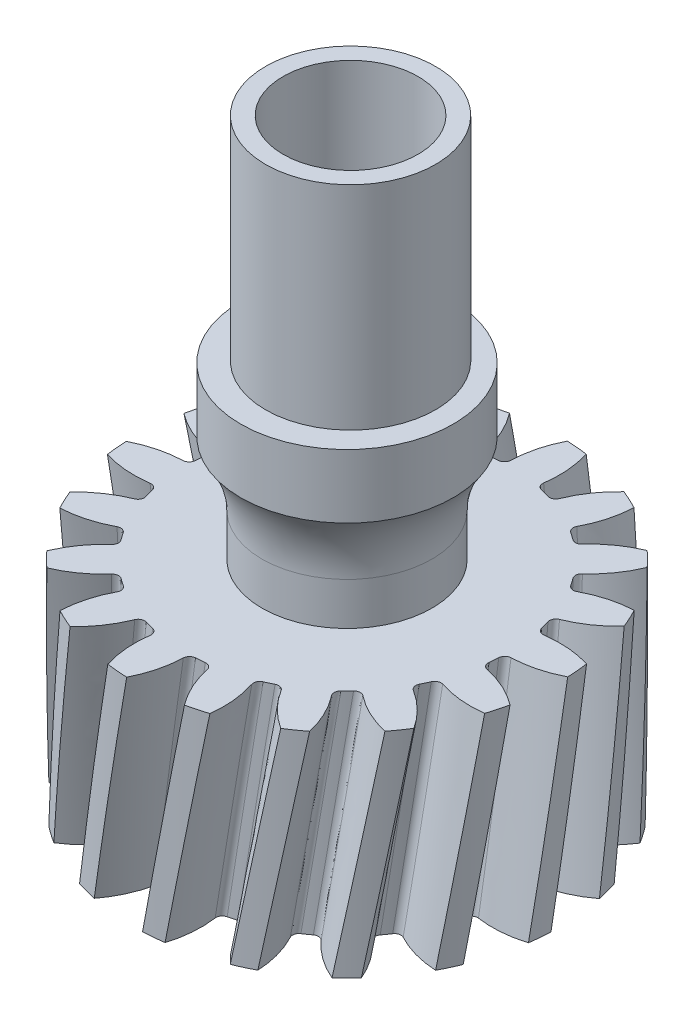
from build123d import *

# Parameters (mm, degrees)
SKETCH1_R                = 10
BOSS_EXTRUDE1_DEPTH      = 5
FILLET2_R                = 0.3
CIRPATTERN3_COUNT        = 18
FILLET2_OF_CIRPATTERN3_R = 0.3
SKETCH8_R                = 4
BOSS_EXTRUDE2_DEPTH      = 5
SKETCH9_R                = 5
BOSS_EXTRUDE4_DEPTH      = 3
FILLET3_R                = 5
SKETCH10_R               = 4
SKETCH10_R_2             = 3.175
BOSS_EXTRUDE5_DEPTH      = 10


with BuildPart() as part:
    # Sketch1 → Boss-Extrude1 (new, symmetric)
    with BuildSketch(Plane(origin=(0, 0, 0), x_dir=(1, 0, 0), z_dir=(0, 1, 0))):
        with Locations(Location((0, 0, 0), (0, 0, 270))):
            Circle(SKETCH1_R)
    extrude(amount=BOSS_EXTRUDE1_DEPTH, both=True)

    # Sketch6 for Cut-Loft1 → Cut-Loft1 section 0
    with BuildSketch(Plane(origin=(0, 5, 0), x_dir=(0.9961060179361225, 0, -0.08816349035423374), z_dir=(0, 1, 0))):
        with BuildLine():
            # circular arc as an exact rational Bezier (weights 1, cos(half-angle), 1)
            Bezier((-1.978587615, 10.820591067), (-0.618030087, 9.485843788), (-0.494114302, 7.58392056), weights=[1, 0.934139297, 1])
            Bezier((-0.494114302, 7.58392056), (0, 7.616113532), (0.494114302, 7.58392056), weights=[1, 0.997884284, 1])
            Bezier((0.494114302, 7.58392056), (0.618030087, 9.485843788), (1.978587615, 10.820591067), weights=[1, 0.934139297, 1])
            Bezier((1.978587615, 10.820591067), (0, 11.182383591), (-1.978587615, 10.820591067), weights=[1, 0.983690097, 1])
        make_face()
    # Sketch2 for Cut-Loft1 → Cut-Loft1 section 1
    with BuildSketch(Plane(origin=(0, 0, 0), x_dir=(1, 0, 0), z_dir=(0, 1, 0))):
        with BuildLine():
            Bezier((-1.978587615, 10.820591067), (-0.618030087, 9.485843788), (-0.494114302, 7.58392056), weights=[1, 0.934139297, 1])
            Bezier((-0.494114302, 7.58392056), (0, 7.616113532), (0.494114302, 7.58392056), weights=[1, 0.997884284, 1])
            Bezier((0.494114302, 7.58392056), (0.618030087, 9.485843788), (1.978587615, 10.820591067), weights=[1, 0.934139297, 1])
            Bezier((1.978587615, 10.820591067), (0, 11.182383591), (-1.978587615, 10.820591067), weights=[1, 0.983690097, 1])
        make_face()
    # Sketch7 for Cut-Loft1 → Cut-Loft1 section 2
    with BuildSketch(Plane(origin=(0, -5, 0), x_dir=(0.9961060179361226, 0, 0.08816349035423311), z_dir=(0, 1, 0))):
        with BuildLine():
            Bezier((-1.978587615, 10.820591067), (-0.618030087, 9.485843788), (-0.494114302, 7.58392056), weights=[1, 0.934139297, 1])
            Bezier((-0.494114302, 7.58392056), (0, 7.616113532), (0.494114302, 7.58392056), weights=[1, 0.997884284, 1])
            Bezier((0.494114302, 7.58392056), (0.618030087, 9.485843788), (1.978587615, 10.820591067), weights=[1, 0.934139297, 1])
            Bezier((1.978587615, 10.820591067), (0, 11.182383591), (-1.978587615, 10.820591067), weights=[1, 0.983690097, 1])
        make_face()
    cut_loft1 = loft(mode=Mode.SUBTRACT)

    # Fillet2
    fillet2_edges = [part.edges().sort_by_distance(p)[0] for p in [
        (0.494114302, 0, -7.58392056),
        (-0.494114302, 0, -7.58392056),
    ]]
    fillet(fillet2_edges, radius=FILLET2_R)

    # CirPattern3: Cut-Loft1 ×18 about axis
    cirpattern3_axis = Axis((0, 5, 0), (0, -1, 0))
    for i in range(1, CIRPATTERN3_COUNT):
        add(cut_loft1.rotate(cirpattern3_axis, i * 360 / CIRPATTERN3_COUNT), mode=Mode.SUBTRACT)

    # Fillet2 of CirPattern3
    fillet2_of_cirpattern3_edges = [part.edges().sort_by_distance(p)[0] for p in [
        (3.05816916, 0, -6.957557142),
        (2.129538033, 0, -7.295551231),
        (5.253363684, 0, -5.492009651),
        (4.496336653, 0, -6.127230753),
        (6.814925016, 0, -3.364044742),
        (6.320810714, 0, -4.219875818),
        (7.554505814, 0, -0.830326389),
        (7.382901717, 0, -1.80354158),
        (7.382901717, 0, 1.80354158),
        (7.554505814, 0, 0.830326389),
        (6.320810714, 0, 4.219875818),
        (6.814925016, 0, 3.364044742),
        (4.496336653, 0, 6.127230753),
        (5.253363684, 0, 5.492009651),
        (2.129538033, 0, 7.295551231),
        (3.05816916, 0, 6.957557142),
        (-0.494114302, 0, 7.58392056),
        (0.494114302, 0, 7.58392056),
        (-3.05816916, 0, 6.957557142),
        (-2.129538033, 0, 7.295551231),
        (-5.253363684, 0, 5.492009651),
        (-4.496336653, 0, 6.127230753),
        (-6.814925016, 0, 3.364044742),
        (-6.320810714, 0, 4.219875818),
        (-7.554505814, 0, 0.830326389),
        (-7.382901717, 0, 1.80354158),
        (-7.382901717, 0, -1.80354158),
        (-7.554505814, 0, -0.830326389),
        (-6.320810714, 0, -4.219875818),
        (-6.814925016, 0, -3.364044742),
        (-4.496336653, 0, -6.127230753),
        (-5.253363684, 0, -5.492009651),
        (-2.129538033, 0, -7.295551231),
        (-3.05816916, 0, -6.957557142),
    ]]
    fillet(fillet2_of_cirpattern3_edges, radius=FILLET2_OF_CIRPATTERN3_R)

    # Sketch8 → Boss-Extrude2 (add)
    with BuildSketch(Plane(origin=(0, 5, 0), x_dir=(1, 0, 0), z_dir=(0, 1, 0))):
        with Locations(Location((0, 0, 0), (0, 0, 270))):
            Circle(SKETCH8_R)
    extrude(amount=BOSS_EXTRUDE2_DEPTH)

    # Sketch9 → Boss-Extrude4 (add)
    with BuildSketch(Plane(origin=(0, 10, 0), x_dir=(1, 0, 0), z_dir=(0, 1, 0))):
        with Locations(Location((0, 0, 0), (0, 0, 270))):
            Circle(SKETCH9_R)
    extrude(amount=BOSS_EXTRUDE4_DEPTH)

    # Fillet3
    # the kernel refuses this fillet: 5 mm, written as the material it adds along each edge
    with BuildSketch(Plane(origin=(0, 10, 0), x_dir=(0, 0, 1), z_dir=(-1, 0, 0))) as fillet3_piece_1:
        with BuildLine():
            CenterArc((9, -3), FILLET3_R, 143.130102354, 36.869897646)
            Line((4, -3), (3.9, -3))
            Line((3.9, -3), (3.9, 0))
            Line((3.9, 0), (4, 0.1))
            ThreePointArc((4, 0.1), (4.5, 0.1), (4.92, 0.06))
            Line((4.92, 0.06), (5, 0))
        make_face()
    revolve(axis=Axis((0, 10, 0), (0, 1, 0)))

    # Sketch10 → Boss-Extrude5 (add)
    with BuildSketch(Plane(origin=(0, 13, 0), x_dir=(1, 0, 0), z_dir=(0, 1, 0))):
        with Locations(Location((0, 0.167249333, 0), (0, 0, 270))):
            Circle(SKETCH10_R)
        with Locations(Location((0, 0.167249333, 0), (0, 0, 270))):
            Circle(SKETCH10_R_2, mode=Mode.SUBTRACT)
    extrude(amount=BOSS_EXTRUDE5_DEPTH)


solid = part.part
